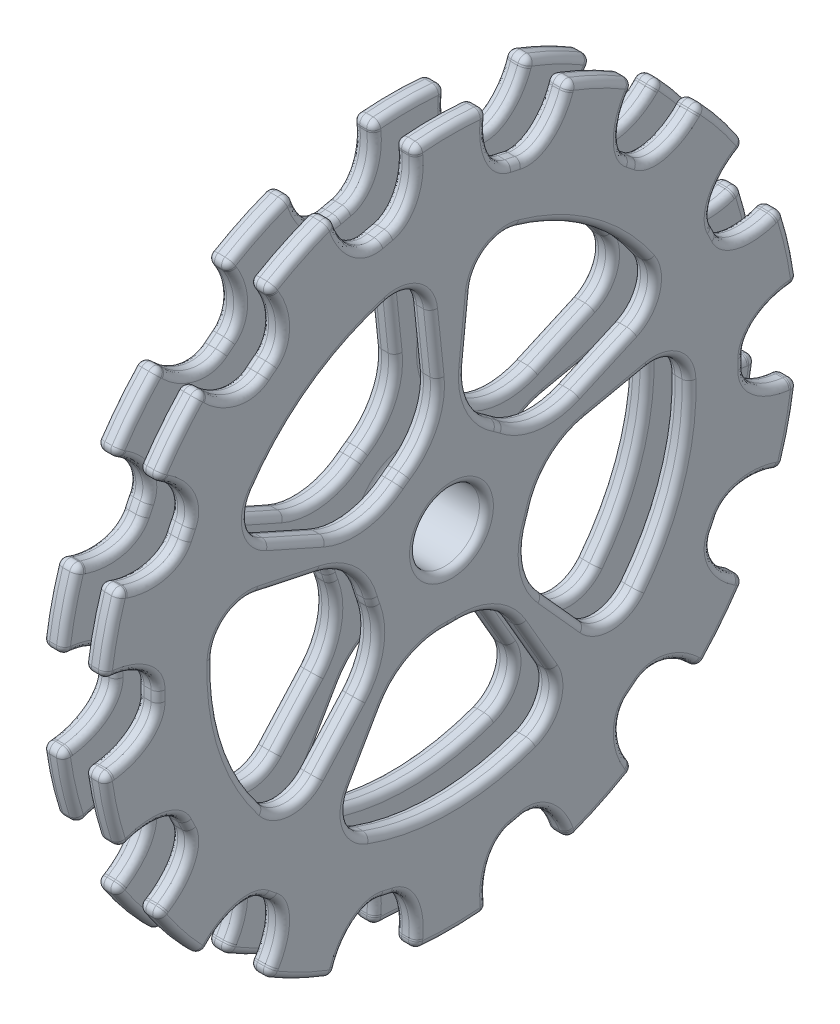
from build123d import *
from OCP.BRepFilletAPI import BRepFilletAPI_MakeFillet

# Parameters (mm, degrees)
SKETCH_2_W                = 3
SKETCH_2_H                = 22
REVOLVE_3_ANGLE           = 6
REVOLVE_3_OTHER_WAY_ANGLE = 6
PATTERN_CIRCULAR_1_COUNT  = 5
SKETCH_2_9_W              = 3
SKETCH_2_9_H              = 8
REVOLVE_4_ANGLE           = 6
REVOLVE_4_OTHER_WAY_ANGLE = 6
PATTERN_CIRCULAR_2_COUNT  = 14
SKETCH_2_10_W             = 3
SKETCH_2_10_H             = 8
FILLET_8_R1               = 5
FILLET_8_R2               = 10
FILLET_9_R                = 1


with BuildPart() as part:
    # Эскиз2 → Повернуть3 (revolve)
    with BuildSketch(Plane.XY):
        with Locations((3, 23)):
            Rectangle(SKETCH_2_W, SKETCH_2_H)
    revolve(axis=Axis((0, 0, 0), (1, 0, 0)), revolution_arc=REVOLVE_3_ANGLE)

    # Эскиз2 → Повернуть3 other way (revolve)
    with BuildSketch(Plane.XY):
        with Locations((3, 23)):
            Rectangle(SKETCH_2_W, SKETCH_2_H)
    revolve(axis=Axis((0, 0, 0), (-1, 0, 0)), revolution_arc=REVOLVE_3_OTHER_WAY_ANGLE)


with BuildPart() as pattern_circular_1_1:
    # Круговой массив1: pattern copy
    add(part.part.rotate(Axis((0, 0, 0), (1, 0, 0)), 1 * 360 / PATTERN_CIRCULAR_1_COUNT))


with BuildPart() as pattern_circular_1_2:
    # Круговой массив1: pattern copy
    add(part.part.rotate(Axis((0, 0, 0), (1, 0, 0)), 2 * 360 / PATTERN_CIRCULAR_1_COUNT))


with BuildPart() as pattern_circular_1_3:
    # Круговой массив1: pattern copy
    add(part.part.rotate(Axis((0, 0, 0), (1, 0, 0)), 3 * 360 / PATTERN_CIRCULAR_1_COUNT))


with BuildPart() as pattern_circular_1_4:
    # Круговой массив1: pattern copy
    add(part.part.rotate(Axis((0, 0, 0), (1, 0, 0)), 4 * 360 / PATTERN_CIRCULAR_1_COUNT))


with BuildPart() as body_6:
    # Эскиз2<9> → Повернуть4 (revolve)
    with BuildSketch(Plane.XY):
        with Locations((3, 46)):
            Rectangle(SKETCH_2_9_W, SKETCH_2_9_H)
    revolve(axis=Axis((0, 0, 0), (1, 0, 0)), revolution_arc=REVOLVE_4_ANGLE)

    # Эскиз2<9> → Повернуть4 other way (revolve)
    with BuildSketch(Plane.XY):
        with Locations((3, 46)):
            Rectangle(SKETCH_2_9_W, SKETCH_2_9_H)
    revolve(axis=Axis((0, 0, 0), (-1, 0, 0)), revolution_arc=REVOLVE_4_OTHER_WAY_ANGLE)


with BuildPart() as pattern_circular_2_1:
    # Круговой массив2: pattern copy
    add(body_6.part.rotate(Axis((0, 0, 0), (1, 0, 0)), 1 * 360 / PATTERN_CIRCULAR_2_COUNT))


with BuildPart() as pattern_circular_2_2:
    # Круговой массив2: pattern copy
    add(body_6.part.rotate(Axis((0, 0, 0), (1, 0, 0)), 2 * 360 / PATTERN_CIRCULAR_2_COUNT))


with BuildPart() as pattern_circular_2_3:
    # Круговой массив2: pattern copy
    add(body_6.part.rotate(Axis((0, 0, 0), (1, 0, 0)), 3 * 360 / PATTERN_CIRCULAR_2_COUNT))


with BuildPart() as pattern_circular_2_4:
    # Круговой массив2: pattern copy
    add(body_6.part.rotate(Axis((0, 0, 0), (1, 0, 0)), 4 * 360 / PATTERN_CIRCULAR_2_COUNT))


with BuildPart() as pattern_circular_2_5:
    # Круговой массив2: pattern copy
    add(body_6.part.rotate(Axis((0, 0, 0), (1, 0, 0)), 5 * 360 / PATTERN_CIRCULAR_2_COUNT))


with BuildPart() as pattern_circular_2_6:
    # Круговой массив2: pattern copy
    add(body_6.part.rotate(Axis((0, 0, 0), (1, 0, 0)), 6 * 360 / PATTERN_CIRCULAR_2_COUNT))


with BuildPart() as pattern_circular_2_7:
    # Круговой массив2: pattern copy
    add(body_6.part.rotate(Axis((0, 0, 0), (1, 0, 0)), 7 * 360 / PATTERN_CIRCULAR_2_COUNT))


with BuildPart() as pattern_circular_2_8:
    # Круговой массив2: pattern copy
    add(body_6.part.rotate(Axis((0, 0, 0), (1, 0, 0)), 8 * 360 / PATTERN_CIRCULAR_2_COUNT))


with BuildPart() as pattern_circular_2_9:
    # Круговой массив2: pattern copy
    add(body_6.part.rotate(Axis((0, 0, 0), (1, 0, 0)), 9 * 360 / PATTERN_CIRCULAR_2_COUNT))


with BuildPart() as pattern_circular_2_10:
    # Круговой массив2: pattern copy
    add(body_6.part.rotate(Axis((0, 0, 0), (1, 0, 0)), 10 * 360 / PATTERN_CIRCULAR_2_COUNT))


with BuildPart() as pattern_circular_2_11:
    # Круговой массив2: pattern copy
    add(body_6.part.rotate(Axis((0, 0, 0), (1, 0, 0)), 11 * 360 / PATTERN_CIRCULAR_2_COUNT))


with BuildPart() as pattern_circular_2_12:
    # Круговой массив2: pattern copy
    add(body_6.part.rotate(Axis((0, 0, 0), (1, 0, 0)), 12 * 360 / PATTERN_CIRCULAR_2_COUNT))


with BuildPart() as pattern_circular_2_13:
    # Круговой массив2: pattern copy
    add(body_6.part.rotate(Axis((0, 0, 0), (1, 0, 0)), 13 * 360 / PATTERN_CIRCULAR_2_COUNT))


with BuildPart() as part_1:
    add(part.part)

    add(pattern_circular_1_1.part)  # Повернуть5 merges Круговой массив1_1

    add(pattern_circular_1_2.part)  # Повернуть5 merges Круговой массив1_2

    add(pattern_circular_1_3.part)  # Повернуть5 merges Круговой массив1_3

    add(pattern_circular_1_4.part)  # Повернуть5 merges Круговой массив1_4

    add(body_6.part)  # Повернуть5 merges body 6

    add(pattern_circular_2_1.part)  # Повернуть5 merges Круговой массив2_1

    add(pattern_circular_2_2.part)  # Повернуть5 merges Круговой массив2_2

    add(pattern_circular_2_3.part)  # Повернуть5 merges Круговой массив2_3

    add(pattern_circular_2_4.part)  # Повернуть5 merges Круговой массив2_4

    add(pattern_circular_2_5.part)  # Повернуть5 merges Круговой массив2_5

    add(pattern_circular_2_6.part)  # Повернуть5 merges Круговой массив2_6

    add(pattern_circular_2_7.part)  # Повернуть5 merges Круговой массив2_7

    add(pattern_circular_2_8.part)  # Повернуть5 merges Круговой массив2_8

    add(pattern_circular_2_9.part)  # Повернуть5 merges Круговой массив2_9

    add(pattern_circular_2_10.part)  # Повернуть5 merges Круговой массив2_10

    add(pattern_circular_2_11.part)  # Повернуть5 merges Круговой массив2_11

    add(pattern_circular_2_12.part)  # Повернуть5 merges Круговой массив2_12

    add(pattern_circular_2_13.part)  # Повернуть5 merges Круговой массив2_13
    # Эскиз2<10> → Повернуть5 (revolve)
    with BuildSketch(Plane.XY, mode=Mode.PRIVATE) as revolve_5_sk:
        Polygon((0, 7), (0, 5), (4.5, 5), (4.5, 12), (1.5, 12), (1.5, 7), align=None)
        with Locations((3, 38)):
            Rectangle(SKETCH_2_10_W, SKETCH_2_10_H)
    revolve(revolve_5_sk.sketch.rotate(Axis((0, 0, 0), (1, 0, 0)), 90), axis=Axis((0, 0, 0), (1, 0, 0)))

    # Скругление10
    # a fillet whose section is not a circle: 7, 5 mm, written as the material it adds along each edge
    with BuildSketch(Plane(origin=(1.5, 41.769919605, -4.390195457), x_dir=(0, -0.15519922718041526, -0.9878831914161724), z_dir=(1, 0, 0)), Plane(origin=(1.5, 35.728562759, -22.078718332), x_dir=(0, -0.5684561249151051, -0.8227135795928631), z_dir=(1, 0, 0)), Plane(origin=(1.5, 22.610725876, -35.394280263), x_dir=(0, -0.8691233154535012, -0.4945954534112843), z_dir=(1, 0, 0)), Plane(origin=(1.5, 5.014557431, -41.699570906), x_dir=(0, -0.99764997426837, -0.06851663186643607), z_dir=(1, 0, 0)), Plane(origin=(1.5, -13.574805613, -39.74575012), x_dir=(0, -0.9285798203054014, 0.37113274892090625), z_dir=(1, 0, 0)), Plane(origin=(1.5, -29.475511921, -29.919796072), x_dir=(0, -0.6755930446468078, 0.7372747371400001), z_dir=(1, 0, 0)), Plane(origin=(1.5, -39.5382316, -14.16785947), x_dir=(0, -0.2887967808909648, 0.9573904215872521), z_dir=(1, 0, 0)), Plane(origin=(1.5, -41.769919605, 4.390195457), x_dir=(0, 0.15519922718041657, 0.9878831914161723), z_dir=(1, 0, 0)), Plane(origin=(1.5, -35.728562759, 22.078718332), x_dir=(0, 0.5684561249151041, 0.822713579592864), z_dir=(1, 0, 0)), Plane(origin=(1.5, -22.610725876, 35.394280263), x_dir=(0, 0.8691233154535007, 0.494595453411285), z_dir=(1, 0, 0)), Plane(origin=(1.5, -5.014557431, 41.699570906), x_dir=(0, 0.99764997426837, 0.06851663186643561), z_dir=(1, 0, 0)), Plane(origin=(1.5, 13.574805613, 39.74575012), x_dir=(0, 0.9285798203054016, -0.3711327489209057), z_dir=(1, 0, 0)), Plane(origin=(1.5, 29.475511921, 29.919796072), x_dir=(0, 0.6755930446468073, -0.7372747371400008), z_dir=(1, 0, 0)), Plane(origin=(1.5, 39.5382316, 14.16785947), x_dir=(0, 0.2887967808909642, -0.9573904215872522), z_dir=(1, 0, 0))) as fillet_10_piece_1:
        with BuildLine():
            Bezier((4.291317886, 0), (-0.011258651, 0.220093632), (-0.344543294, 6.735423816), weights=[1, 0.742307489, 1])
            Line((-0.344543294, 6.735423816), (0, 0))
            ThreePointArc((0, 0), (2.145658943, 0.054843573), (4.291317886, 0))
        make_face()
    extrude(amount=3)

    # Скругление11
    # a fillet whose section is not a circle: 7, 5 mm, written as the material it adds along each edge
    with BuildSketch(Plane(origin=(1.5, 41.769919605, 4.390195457), x_dir=(0, -0.15519922718041645, 0.9878831914161721), z_dir=(1, 0, 0)), Plane(origin=(1.5, 35.728562759, 22.078718332), x_dir=(0, -0.5684561249151067, 0.8227135795928621), z_dir=(1, 0, 0)), Plane(origin=(1.5, 22.610725876, 35.394280263), x_dir=(0, -0.8691233154535005, 0.49459545341128536), z_dir=(1, 0, 0)), Plane(origin=(1.5, 5.014557431, 41.699570906), x_dir=(0, -0.99764997426837, 0.06851663186643592), z_dir=(1, 0, 0)), Plane(origin=(1.5, -13.574805613, 39.74575012), x_dir=(0, -0.9285798203054014, -0.37113274892090625), z_dir=(1, 0, 0)), Plane(origin=(1.5, -29.475511921, 29.919796072), x_dir=(0, -0.6755930446468079, -0.7372747371400001), z_dir=(1, 0, 0)), Plane(origin=(1.5, -39.5382316, 14.16785947), x_dir=(0, -0.28879678089096333, -0.9573904215872525), z_dir=(1, 0, 0)), Plane(origin=(1.5, -41.769919605, -4.390195457), x_dir=(0, 0.1551992271804161, -0.9878831914161723), z_dir=(1, 0, 0)), Plane(origin=(1.5, -35.728562759, -22.078718332), x_dir=(0, 0.5684561249151044, -0.8227135795928636), z_dir=(1, 0, 0)), Plane(origin=(1.5, -22.610725876, -35.394280263), x_dir=(0, 0.8691233154535004, -0.49459545341128575), z_dir=(1, 0, 0)), Plane(origin=(1.5, -5.014557431, -41.699570906), x_dir=(0, 0.99764997426837, -0.06851663186643588), z_dir=(1, 0, 0)), Plane(origin=(1.5, 13.574805613, -39.74575012), x_dir=(0, 0.9285798203053999, 0.3711327489209099), z_dir=(1, 0, 0)), Plane(origin=(1.5, 29.475511921, -29.919796072), x_dir=(0, 0.6755930446468084, 0.7372747371399996), z_dir=(1, 0, 0)), Plane(origin=(1.5, 39.5382316, -14.16785947), x_dir=(0, 0.2887967808909646, 0.957390421587252), z_dir=(1, 0, 0))) as fillet_11_piece_1:
        with BuildLine():
            Bezier((4.291317886, 0), (-0.011258651, -0.220093632), (-0.344543294, -6.735423816), weights=[1, 0.742307489, 1])
            Line((-0.344543294, -6.735423816), (0, 0))
            ThreePointArc((0, 0), (2.145658943, -0.054843573), (4.291317886, 0))
        make_face()
    extrude(amount=3)

    # Скругление8: one fillet with a radius per group of edges: ONE call of the kernel's fillet builder (fillet() takes one radius for all edges)
    fillet_8_edges_1 = [part_1.edges().sort_by_distance(p)[0] for p in [
        (3, 33.813744443, 3.553967751),
        (3, 13.829045865, 31.06054556),
        (3, 7.068997488, 33.257018425),
        (3, -25.266924066, 22.750440616),
        (3, -29.444863729, 17),
        (3, -29.444863729, -17),
        (3, -25.266924066, -22.750440616),
        (3, 7.068997488, -33.257018425),
        (3, 33.813744443, -3.553967751),
        (3, 13.829045865, -31.06054556),
    ]]
    fillet_8_edges_2 = [part_1.edges().sort_by_distance(p)[0] for p in [
        (3, -10.392304845, -6),
        (3, -10.392304845, 6),
        (3, 2.49494029, 11.737771209),
        (3, -8.917737906, 8.029567276),
        (3, 4.880839717, 10.962545492),
        (3, 11.934262744, 1.254341559),
        (3, 11.934262744, -1.254341559),
        (3, 4.880839717, -10.962545492),
        (3, 2.49494029, -11.737771209),
        (3, -8.917737906, -8.029567276),
    ]]
    fillet_8 = BRepFilletAPI_MakeFillet(part_1.part.solid().wrapped)
    for e in fillet_8_edges_1:
        fillet_8.Add(FILLET_8_R1, e.wrapped)
    for e in fillet_8_edges_2:
        fillet_8.Add(FILLET_8_R2, e.wrapped)
    add(Compound.cast(fillet_8.Shape()), mode=Mode.REPLACE)

    # Скругление9
    fillet_9_edges = [part_1.edges().sort_by_distance(p)[0] for p in [
        (1.5, 11.126046698, -48.746395609),
        (1.5, 5.89474541, -49.018952837),
        (4.5, 11.126046698, -48.746395609),
        (3, 5.969711227, -49.642346317),
        (1.5, 15.957544446, -46.722184623),
        (3, 16.160482873, -47.31636919),
        (1.5, -11.126046698, -48.746395609),
        (1.5, -15.957544446, -46.722184623),
        (4.5, -11.126046698, -48.746395609),
        (3, -16.160482873, -47.31636919),
        (1.5, -5.89474541, -49.018952837),
        (3, -5.969711227, -49.642346317),
        (1.5, -31.174490093, -39.091574123),
        (1.5, -34.649246918, -35.171514734),
        (4.5, -31.174490093, -39.091574123),
        (3, -35.089895144, -35.618804848),
        (1.5, -26.579508643, -41.606916264),
        (3, -26.917530805, -42.136047933),
        (1.5, -45.048443395, -21.694186956),
        (1.5, -46.478241093, -16.654695002),
        (4.5, -45.048443395, -21.694186956),
        (3, -47.069323333, -16.866499369),
        (1.5, -41.999874213, -25.954119649),
        (3, -42.534003284, -26.284188491),
        (1.5, -50, 0),
        (1.5, -49.101649601, 5.160791332),
        (4.5, -50, 0),
        (3, -49.726094768, 5.226423163),
        (1.5, -49.101649601, -5.160791332),
        (3, -49.726094768, -5.226423163),
        (1.5, 0, -7),
        (4.5, 0, -5),
        (1.5, -45.048443395, 21.694186956),
        (1.5, -41.999874213, 25.954119649),
        (4.5, -45.048443395, 21.694186956),
        (3, -42.534003284, 26.284188491),
        (1.5, -46.478241093, 16.654695002),
        (3, -47.069323333, 16.866499369),
        (1.5, -31.174490093, 39.091574123),
        (1.5, -26.579508643, 41.606916264),
        (4.5, -31.174490093, 39.091574123),
        (3, -26.917530805, 42.136047933),
        (1.5, -34.649246918, 35.171514734),
        (3, -35.089895144, 35.618804848),
        (1.5, -11.126046698, 48.746395609),
        (1.5, -5.89474541, 49.018952837),
        (4.5, -11.126046698, 48.746395609),
        (3, -5.969711227, 49.642346317),
        (1.5, -15.957544446, 46.722184623),
        (3, -16.160482873, 47.31636919),
        (1.5, 11.126046698, 48.746395609),
        (1.5, 15.957544446, 46.722184623),
        (4.5, 11.126046698, 48.746395609),
        (3, 16.160482873, 47.31636919),
        (1.5, 5.89474541, 49.018952837),
        (3, 5.969711227, 49.642346317),
        (1.5, 31.174490093, 39.091574123),
        (1.5, 34.649246918, 35.171514734),
        (4.5, 31.174490093, 39.091574123),
        (3, 35.089895144, 35.618804848),
        (1.5, 26.579508643, 41.606916264),
        (3, 26.917530805, 42.136047933),
        (1.5, 45.048443395, 21.694186956),
        (1.5, 46.478241093, 16.654695002),
        (4.5, 45.048443395, 21.694186956),
        (3, 47.069323333, 16.866499369),
        (1.5, 41.999874213, 25.954119649),
        (3, 42.534003284, 26.284188491),
        (1.5, 40.946972312, -9.345879226),
        (4.5, 40.946972312, -9.345879226),
        (4.5, 49.101649601, -5.160791332),
        (1.5, 32.836922264, -26.186571678),
        (4.5, 32.836922264, -26.186571678),
        (4.5, 41.999874213, -25.954119649),
        (1.5, 18.223117043, -37.840692452),
        (4.5, 18.223117043, -37.840692452),
        (4.5, 26.579508643, -41.606916264),
        (1.5, 0, -42),
        (4.5, 0, -42),
        (4.5, 5.89474541, -49.018952837),
        (1.5, -18.223117043, -37.840692452),
        (4.5, -18.223117043, -37.840692452),
        (4.5, -15.957544446, -46.722184623),
        (1.5, -32.836922264, -26.186571678),
        (4.5, -32.836922264, -26.186571678),
        (4.5, -34.649246918, -35.171514734),
        (1.5, -40.946972312, -9.345879226),
        (4.5, -40.946972312, -9.345879226),
        (4.5, -46.478241093, -16.654695002),
        (1.5, -40.946972312, 9.345879226),
        (4.5, -40.946972312, 9.345879226),
        (4.5, -49.101649601, 5.160791332),
        (1.5, -32.836922264, 26.186571678),
        (4.5, -32.836922264, 26.186571678),
        (4.5, -41.999874213, 25.954119649),
        (1.5, -18.223117043, 37.840692452),
        (4.5, -18.223117043, 37.840692452),
        (4.5, -26.579508643, 41.606916264),
        (1.5, 0, 42),
        (4.5, 0, 42),
        (4.5, -5.89474541, 49.018952837),
        (1.5, 18.223117043, 37.840692452),
        (4.5, 18.223117043, 37.840692452),
        (4.5, 15.957544446, 46.722184623),
        (1.5, 32.836922264, 26.186571678),
        (4.5, 32.836922264, 26.186571678),
        (4.5, 34.649246918, 35.171514734),
        (1.5, 40.946972312, 9.345879226),
        (4.5, 40.946972312, 9.345879226),
        (4.5, 46.478241093, 16.654695002),
        (4.5, 44.102639975, -5.601173588),
        (1.5, 44.102639975, -5.601173588),
        (4.5, 37.30484747, -24.181901364),
        (1.5, 37.30484747, -24.181901364),
        (4.5, 23.11837241, -37.973107003),
        (1.5, 23.11837241, -37.973107003),
        (4.5, 4.353020165, -44.243273091),
        (1.5, 4.353020165, -44.243273091),
        (4.5, -15.274501109, -41.750516334),
        (1.5, -15.274501109, -41.750516334),
        (4.5, -31.876720109, -30.988557782),
        (1.5, -31.876720109, -30.988557782),
        (4.5, -42.16536375, -14.088935311),
        (1.5, -42.16536375, -14.088935311),
        (4.5, -44.102639975, 5.601173588),
        (1.5, -44.102639975, 5.601173588),
        (4.5, -37.30484747, 24.181901364),
        (1.5, -37.30484747, 24.181901364),
        (4.5, -23.11837241, 37.973107003),
        (1.5, -23.11837241, 37.973107003),
        (4.5, -4.353020165, 44.243273091),
        (1.5, -4.353020165, 44.243273091),
        (4.5, 15.274501109, 41.750516334),
        (1.5, 15.274501109, 41.750516334),
        (4.5, 31.876720109, 30.988557782),
        (1.5, 31.876720109, 30.988557782),
        (4.5, 42.16536375, 14.088935311),
        (1.5, 42.16536375, 14.088935311),
        (4.5, 49.101649601, 5.160791332),
        (4.5, 41.999874213, 25.954119649),
        (4.5, 26.579508643, 41.606916264),
        (4.5, 5.89474541, 49.018952837),
        (4.5, -15.957544446, 46.722184623),
        (4.5, -34.649246918, 35.171514734),
        (4.5, -46.478241093, 16.654695002),
        (4.5, -49.101649601, -5.160791332),
        (4.5, -41.999874213, -25.954119649),
        (4.5, -26.579508643, -41.606916264),
        (4.5, -5.89474541, -49.018952837),
        (4.5, 15.957544446, -46.722184623),
        (4.5, 34.649246918, -35.171514734),
        (4.5, 46.478241093, -16.654695002),
        (4.5, 44.102639975, 5.601173588),
        (1.5, 44.102639975, 5.601173588),
        (4.5, 37.30484747, 24.181901364),
        (1.5, 37.30484747, 24.181901364),
        (4.5, 23.11837241, 37.973107003),
        (1.5, 23.11837241, 37.973107003),
        (4.5, 4.353020165, 44.243273091),
        (1.5, 4.353020165, 44.243273091),
        (4.5, -15.274501109, 41.750516334),
        (1.5, -15.274501109, 41.750516334),
        (4.5, -31.876720109, 30.988557782),
        (1.5, -31.876720109, 30.988557782),
        (4.5, -42.16536375, 14.088935311),
        (1.5, -42.16536375, 14.088935311),
        (4.5, -44.102639975, -5.601173588),
        (1.5, -44.102639975, -5.601173588),
        (4.5, -37.30484747, -24.181901364),
        (1.5, -37.30484747, -24.181901364),
        (4.5, -23.11837241, -37.973107003),
        (1.5, -23.11837241, -37.973107003),
        (4.5, -4.353020165, -44.243273091),
        (1.5, -4.353020165, -44.243273091),
        (4.5, 15.274501109, -41.750516334),
        (1.5, 15.274501109, -41.750516334),
        (4.5, 31.876720109, -30.988557782),
        (1.5, 31.876720109, -30.988557782),
        (4.5, 42.16536375, -14.088935311),
        (1.5, 42.16536375, -14.088935311),
        (1.5, -17.895533676, -16.113210897),
        (4.5, -17.895533676, -16.113210897),
        (1.5, -3.708203932, -11.412678196),
        (4.5, -3.708203932, -11.412678196),
        (1.5, 5.006683135, -23.554592226),
        (4.5, 5.006683135, -23.554592226),
        (1.5, 9.794550192, -21.998919916),
        (4.5, 9.794550192, -21.998919916),
        (1.5, 9.708203932, -7.053423028),
        (4.5, 9.708203932, -7.053423028),
        (1.5, 23.948898599, -2.517130673),
        (4.5, 23.948898599, -2.517130673),
        (1.5, 23.948898599, 2.517130673),
        (4.5, 23.948898599, 2.517130673),
        (1.5, 9.708203932, 7.053423028),
        (4.5, 9.708203932, 7.053423028),
        (1.5, 9.794550192, 21.998919916),
        (4.5, 9.794550192, 21.998919916),
        (1.5, -3.708203932, 11.412678196),
        (4.5, -3.708203932, 11.412678196),
        (1.5, -17.895533676, 16.113210897),
        (4.5, -17.895533676, 16.113210897),
        (1.5, 5.006683135, 23.554592226),
        (4.5, 5.006683135, 23.554592226),
        (1.5, -20.854598251, 12.040407914),
        (4.5, -20.854598251, 12.040407914),
        (1.5, -12, 0),
        (4.5, -12, 0),
        (1.5, -20.854598251, -12.040407914),
        (4.5, -20.854598251, -12.040407914),
        (4.5, 27.506577809, -19.984698578),
        (1.5, 27.506577809, -19.984698578),
        (4.5, -10.506577809, -32.335921554),
        (1.5, -10.506577809, -32.335921554),
        (4.5, -34, 0),
        (1.5, 50, 0),
        (1.5, -34, 0),
        (1.5, 49.101649601, -5.160791332),
        (4.5, -10.506577809, 32.335921554),
        (1.5, -10.506577809, 32.335921554),
        (4.5, 27.506577809, 19.984698578),
        (1.5, 27.506577809, 19.984698578),
        (4.5, 50, 0),
        (4.5, -9.696716662, -10.711695719),
        (3, 49.726094768, -5.226423163),
        (1.5, 49.101649601, 5.160791332),
        (1.5, -9.696716662, -10.711695719),
        (3, 49.726094768, 5.226423163),
        (4.5, 1.548631799, -14.365530925),
        (1.5, 1.548631799, -14.365530925),
        (4.5, 7.190977776, -12.532221584),
        (1.5, 7.190977776, -12.532221584),
        (4.5, 14.14098534, -2.966356826),
        (1.5, 14.14098534, -2.966356826),
        (4.5, 14.14098534, 2.966356826),
        (1.5, 14.14098534, 2.966356826),
        (4.5, 7.190977776, 12.532221584),
        (1.5, 7.190977776, 12.532221584),
        (4.5, -9.696716662, 10.711695719),
        (1.5, -9.696716662, 10.711695719),
        (4.5, 1.548631799, 14.365530925),
        (1.5, 1.548631799, 14.365530925),
        (4.5, -13.183878253, 5.912029553),
        (1.5, -13.183878253, 5.912029553),
        (4.5, -13.183878253, -5.912029553),
        (1.5, -13.183878253, -5.912029553),
        (4.5, 14.805251437, -28.867838696),
        (1.5, 14.805251437, -28.867838696),
        (4.5, 32.030020403, -5.159978107),
        (1.5, 32.030020403, -5.159978107),
        (4.5, 4.990389832, -32.056880547),
        (1.5, 4.990389832, -32.056880547),
        (4.5, -22.879871803, -23.001283602),
        (1.5, -22.879871803, -23.001283602),
        (4.5, -28.945789869, -14.652263645),
        (1.5, -28.945789869, -14.652263645),
        (4.5, -28.945789869, 14.652263645),
        (1.5, -28.945789869, 14.652263645),
        (4.5, -22.879871803, 23.001283602),
        (1.5, -22.879871803, 23.001283602),
        (4.5, 4.990389832, 32.056880547),
        (1.5, 4.990389832, 32.056880547),
        (4.5, 14.805251437, 28.867838696),
        (1.5, 45.048443395, -21.694186956),
        (1.5, 14.805251437, 28.867838696),
        (1.5, 41.999874213, -25.954119649),
        (4.5, 32.030020403, 5.159978107),
        (1.5, 32.030020403, 5.159978107),
        (4.5, 45.048443395, -21.694186956),
        (3, 42.534003284, -26.284188491),
        (1.5, 46.478241093, -16.654695002),
        (3, 47.069323333, -16.866499369),
        (1.5, 31.174490093, -39.091574123),
        (1.5, 26.579508643, -41.606916264),
        (4.5, 31.174490093, -39.091574123),
        (3, 26.917530805, -42.136047933),
        (1.5, 34.649246918, -35.171514734),
        (3, 35.089895144, -35.618804848),
    ]]
    fillet(fillet_9_edges, radius=FILLET_9_R)

    # Зеркальное отражение1: part across plane


with BuildPart() as part_2:
    add(part_1.part)
    add(part_1.part.mirror(Plane(origin=(0, 0, 0), x_dir=(0, 0, 1), z_dir=(1, 0, 0))))


solid = part_2.part
